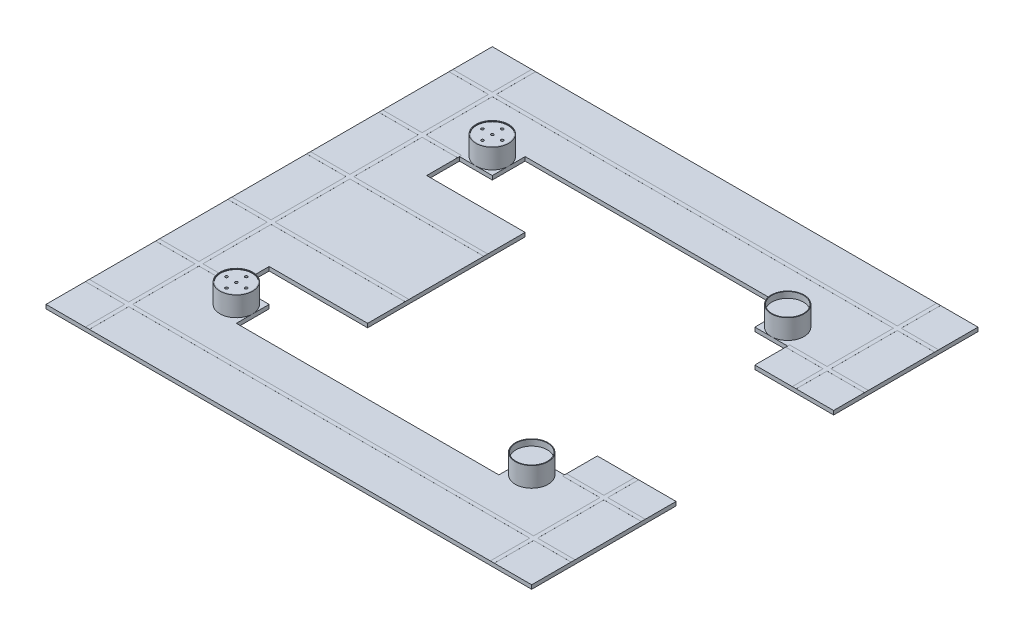
from build123d import *

# Parameters (mm, degrees)
SKETCH1_W               = 3700
SKETCH1_H               = 3400
SKETCH1_W_2             = 2500
SKETCH1_H_2             = 500
SKETCH1_W_3             = 250
SKETCH1_H_3             = 250
BOSS_EXTRUDE1_DEPTH     = 30
BOSS_EXTRUDE2_DEPTH     = 600
SKETCH3_R               = 125
BOSS_EXTRUDE3_DEPTH     = 150
SKETCH4_R               = 120
CUT_EXTRUDE1_DEPTH      = 5
SKETCH5_R               = 10
CUT_EXTRUDE2_DEPTH      = 20
MIRROR3_COPY_1_SKETCH_R = 125
MIRROR3_COPY_1_DEPTH    = 150
MIRROR3_COPY_2_SKETCH_R = 120
MIRROR3_COPY_2_DEPTH    = 5
MIRROR3_COPY_3_SKETCH_R = 10
MIRROR3_COPY_3_DEPTH    = 20
SKETCH6_R               = 120
CUT_EXTRUDE3_DEPTH      = 40
SKETCH7_W               = 300
SKETCH7_H               = 300
BOSS_EXTRUDE4_DEPTH     = 0.1
SKETCH8_W               = 3700
SKETCH8_H               = 30
SKETCH8_W_2             = 30
SKETCH8_H_2             = 3400
SKETCH8_W_3             = 600
SKETCH8_W_4             = 2350
EXTRUDE_THIN1_DEPTH     = 0.2
SKETCH9_W               = 230.740107676
SKETCH9_H               = 30
EXTRUDE_THIN2_DEPTH     = 0.1
SKETCH10_W              = 600
SKETCH10_H              = 30
EXTRUDE_THIN3_DEPTH     = 0.1
SKETCH11_R              = 21
BOSS_EXTRUDE5_DEPTH     = 350
SPLIT3_SURFACE_1_BACK   = 5040.286
SPLIT3_SURFACE_1_DEPTH  = 10080.572
SPLIT3_SURFACE_2_BACK   = 5040.286
SPLIT3_SURFACE_2_DEPTH  = 10080.572
SAVE_START              = -600
SAVE_BODIES1_DEPTH      = 1200
SPLIT5_SURFACE_3_BACK   = 5040.286
SPLIT5_SURFACE_3_DEPTH  = 10080.572
SPLIT5_SURFACE_4_BACK   = 5040.286
SPLIT5_SURFACE_4_DEPTH  = 10080.572
SAVE_BODIES2_OUTLINE_W  = 1350
SAVE_BODIES2_OUTLINE_H  = 1200
SAVE_BODIES2_DEPTH      = 380


# Read off the part's stored shape, not the designer's step: Save Bodies1, Save Bodies2
with BuildPart() as part:
    # Sketch1 → Boss-Extrude1 (new body)
    # profile 1 of 5: a face of its own
    with BuildSketch(Plane(origin=(0, 0, 0), x_dir=(1, 0, 0), z_dir=(0, 1, 0))):
        Rectangle(SKETCH1_W, SKETCH1_H)
        with Locations((0, 850)):
            Rectangle(SKETCH1_W_2, SKETCH1_H_2, mode=Mode.SUBTRACT)
        with Locations((0, -850)):
            Rectangle(SKETCH1_W_2, SKETCH1_H_2, mode=Mode.SUBTRACT)
    # profile 2 of 5: a face of its own
    with BuildSketch(Plane(origin=(0, 0, 0), x_dir=(1, 0, 0), z_dir=(0, 1, 0))):
        with Locations((-1125, 975)):
            Rectangle(SKETCH1_W_3, SKETCH1_H_3)
    # profile 3 of 5: a face of its own
    with BuildSketch(Plane(origin=(0, 0, 0), x_dir=(1, 0, 0), z_dir=(0, 1, 0))):
        with Locations((1125, 975)):
            Rectangle(SKETCH1_W_3, SKETCH1_H_3)
    # profile 4 of 5: a face of its own
    with BuildSketch(Plane(origin=(0, 0, 0), x_dir=(1, 0, 0), z_dir=(0, 1, 0))):
        with Locations((1125, -975)):
            Rectangle(SKETCH1_W_3, SKETCH1_H_3)
    # profile 5 of 5: a face of its own
    with BuildSketch(Plane(origin=(0, 0, 0), x_dir=(1, 0, 0), z_dir=(0, 1, 0))):
        with Locations((-1125, -975)):
            Rectangle(SKETCH1_W_3, SKETCH1_H_3)
    extrude(amount=BOSS_EXTRUDE1_DEPTH)

    # Sketch2 → Boss-Extrude2 (add, symmetric)
    with BuildSketch(Plane.XY):
        Polygon((-500, 30), (-300, 145.470053838), (300, 145.470053838), (500, 30), align=None)
    extrude(amount=BOSS_EXTRUDE2_DEPTH, both=True)

    # Sketch3 → Boss-Extrude3 (add)
    with BuildSketch(Plane(origin=(0, 30, 0), x_dir=(1, 0, 0), z_dir=(0, 1, 0))):
        with Locations(Location((-1125, 975, 0), (0, 0, 270))):
            Circle(SKETCH3_R)
    boss_extrude3 = extrude(amount=BOSS_EXTRUDE3_DEPTH)

    # Sketch4 → Cut-Extrude1 (cut)
    with BuildSketch(Plane(origin=(0, 180, 0), x_dir=(1, 0, 0), z_dir=(0, 1, 0))):
        with Locations(Location((-1125, 975, 0), (0, 0, 270))):
            Circle(SKETCH4_R)
    cut_extrude1 = extrude(amount=-CUT_EXTRUDE1_DEPTH, mode=Mode.SUBTRACT)

    # Sketch5 → Cut-Extrude2 (cut)
    with BuildSketch(Plane(origin=(0, 175, 0), x_dir=(1, 0, 0), z_dir=(0, 1, 0))):
        with Locations(Location((-1125, 975, 0), (0, 0, 270))):
            Circle(SKETCH5_R)
        with Locations(Location((-1050, 975, 0), (0, 0, 270))):
            Circle(SKETCH5_R)
        with Locations(Location((-1125, 900, 0), (0, 0, 270))):
            Circle(SKETCH5_R)
        with Locations(Location((-1200, 975, 0), (0, 0, 270))):
            Circle(SKETCH5_R)
        with Locations(Location((-1125, 1050, 0), (0, 0, 270))):
            Circle(SKETCH5_R)
    cut_extrude2 = extrude(amount=-CUT_EXTRUDE2_DEPTH, mode=Mode.SUBTRACT)

    # Mirror2: Boss-Extrude3, Cut-Extrude1, Cut-Extrude2 across plane
    add(boss_extrude3.mirror(Plane.XY))
    add(cut_extrude1.mirror(Plane.XY), mode=Mode.SUBTRACT)
    add(cut_extrude2.mirror(Plane.XY), mode=Mode.SUBTRACT)

    # Mirror3: Boss-Extrude3, Cut-Extrude1, Cut-Extrude2 across plane
    add(boss_extrude3.mirror(Plane(origin=(0, 0, 0), x_dir=(0, 0, 1), z_dir=(1, 0, 0))))
    add(cut_extrude1.mirror(Plane(origin=(0, 0, 0), x_dir=(0, 0, 1), z_dir=(1, 0, 0))), mode=Mode.SUBTRACT)
    add(cut_extrude2.mirror(Plane(origin=(0, 0, 0), x_dir=(0, 0, 1), z_dir=(1, 0, 0))), mode=Mode.SUBTRACT)

    # Mirror3 copy 1 sketch → Mirror3 copy 1 (add)
    with BuildSketch(Plane(origin=(0, 30, 0), x_dir=(-1, 0, 0), z_dir=(0, 1, 0))):
        with Locations(Location((-1125, 975, 0), (0, 0, 270))):
            Circle(MIRROR3_COPY_1_SKETCH_R)
    extrude(amount=MIRROR3_COPY_1_DEPTH)

    # Mirror3 copy 2 sketch → Mirror3 copy 2 (cut)
    with BuildSketch(Plane(origin=(0, 180, 0), x_dir=(-1, 0, 0), z_dir=(0, 1, 0))):
        with Locations(Location((-1125, 975, 0), (0, 0, 270))):
            Circle(MIRROR3_COPY_2_SKETCH_R)
    extrude(amount=-MIRROR3_COPY_2_DEPTH, mode=Mode.SUBTRACT)

    # Mirror3 copy 3 sketch → Mirror3 copy 3 (cut)
    with BuildSketch(Plane(origin=(0, 175, 0), x_dir=(-1, 0, 0), z_dir=(0, 1, 0))):
        with Locations(Location((-1125, 975, 0), (0, 0, 270))):
            Circle(MIRROR3_COPY_3_SKETCH_R)
        with Locations(Location((-1050, 975, 0), (0, 0, 270))):
            Circle(MIRROR3_COPY_3_SKETCH_R)
        with Locations(Location((-1125, 900, 0), (0, 0, 270))):
            Circle(MIRROR3_COPY_3_SKETCH_R)
        with Locations(Location((-1200, 975, 0), (0, 0, 270))):
            Circle(MIRROR3_COPY_3_SKETCH_R)
        with Locations(Location((-1125, 1050, 0), (0, 0, 270))):
            Circle(MIRROR3_COPY_3_SKETCH_R)
    extrude(amount=-MIRROR3_COPY_3_DEPTH, mode=Mode.SUBTRACT)

    # Sketch6 → Cut-Extrude3 (cut)
    with BuildSketch(Plane(origin=(0, 175, 0), x_dir=(1, 0, 0), z_dir=(0, 1, 0))):
        with Locations(Location((1125, 975, 0), (0, 0, 270))):
            Circle(SKETCH6_R)
    cut_extrude3 = extrude(amount=-CUT_EXTRUDE3_DEPTH, mode=Mode.SUBTRACT)

    # Mirror4: Cut-Extrude3 across plane
    add(cut_extrude3.mirror(Plane.XY), mode=Mode.SUBTRACT)

    # Sketch7 → Boss-Extrude4 (add)
    with BuildSketch(Plane(origin=(0, 30, 0), x_dir=(1, 0, 0), z_dir=(0, 1, 0))):
        with Locations((-1700, 1550)):
            Rectangle(SKETCH7_W, SKETCH7_H)
        with Locations((-1700, -1550)):
            Rectangle(SKETCH7_W, SKETCH7_H)
    extrude(amount=BOSS_EXTRUDE4_DEPTH)

    # Sketch8 → Extrude-Thin1 (add)
    with BuildSketch(Plane(origin=(0, 30, 0), x_dir=(1, 0, 0), z_dir=(0, 1, 0))):
        with Locations((0, 1385)):
            Rectangle(SKETCH8_W, SKETCH8_H)
        with Locations((-1535, 0)):
            Rectangle(SKETCH8_W_2, SKETCH8_H_2)
        with Locations((1550, 0)):
            Rectangle(SKETCH8_W_2, SKETCH8_H_2)
        with Locations((-1550, 850)):
            Rectangle(SKETCH8_W_3, SKETCH8_H)
        with Locations((-675, 300)):
            Rectangle(SKETCH8_W_4, SKETCH8_H)
        with Locations((-675, -300)):
            Rectangle(SKETCH8_W_4, SKETCH8_H)
        with Locations((0, -1385)):
            Rectangle(SKETCH8_W, SKETCH8_H)
        with Locations((-1550, -850)):
            Rectangle(SKETCH8_W_3, SKETCH8_H)
        with Locations((1550, 850)):
            Rectangle(SKETCH8_W_3, SKETCH8_H)
        with Locations((1550, -850)):
            Rectangle(SKETCH8_W_3, SKETCH8_H)
    extrude(amount=EXTRUDE_THIN1_DEPTH)

    # Sketch9 → Extrude-Thin2 (add)
    with BuildSketch(Plane(origin=(-137.990381057, 239.006350946, 0), x_dir=(0.8660254037844415, 0.4999999999999951, 0), z_dir=(-0.49999999999999517, 0.8660254037844416, 0))):
        with Locations((-302.442648054, 300)):
            Rectangle(SKETCH9_W, SKETCH9_H)
        with Locations((-302.442648054, -300)):
            Rectangle(SKETCH9_W, SKETCH9_H)
    extrude_thin2 = extrude(amount=EXTRUDE_THIN2_DEPTH)

    # Sketch10 → Extrude-Thin3 (add)
    with BuildSketch(Plane(origin=(0, 145.470053838, 0), x_dir=(1, 0, 0), z_dir=(0, 1, 0))):
        with Locations((0, 300)):
            Rectangle(SKETCH10_W, SKETCH10_H)
        with Locations((0, -300)):
            Rectangle(SKETCH10_W, SKETCH10_H)
    extrude(amount=EXTRUDE_THIN3_DEPTH)

    # Mirror5: Extrude-Thin2 across plane
    add(extrude_thin2.mirror(Plane(origin=(0, 0, 0), x_dir=(0, 0, 1), z_dir=(1, 0, 0))))

    # Sketch11 → Boss-Extrude5 (add)
    with BuildSketch(Plane(origin=(0, 30, 0), x_dir=(1, 0, 0), z_dir=(0, 1, 0))):
        with Locations(Location((850, -298.836957303, 0), (0, 0, 270))):
            Circle(SKETCH11_R)
        with Locations(Location((1050, -448.836957303, 0), (0, 0, 270))):
            Circle(SKETCH11_R)
        with Locations(Location((1450, -298.836957303, 0), (0, 0, 270))):
            Circle(SKETCH11_R)
        with Locations(Location((1250, -148.836957303, 0), (0, 0, 270))):
            Circle(SKETCH11_R)
    boss_extrude5 = extrude(amount=BOSS_EXTRUDE5_DEPTH)

    # Mirror6: Boss-Extrude5 across plane
    add(boss_extrude5.mirror(Plane.XY))


with BuildPart() as body_2:
    # Split3: the piece behind the surface
    add(part.part)
    # Split3 surface: a surface, the sketch's curves swept straight by 10080.572 mm
    with BuildLine(Plane(origin=(0, 30, 0), x_dir=(1, 0, 0), z_dir=(0, 1, 0)).offset(-SPLIT3_SURFACE_1_BACK), mode=Mode.PRIVATE) as split3_surface_1_path:
        Line((500, -600), (-500, -600))
        Line((-500, -600), (-500, 600))
        Line((-500, 600), (500, 600))
        Line((500, 600), (500, -600))
    split3_surface_1 = Shell.extrude(split3_surface_1_path.wire(), (0 * SPLIT3_SURFACE_1_DEPTH, 1 * SPLIT3_SURFACE_1_DEPTH, 0 * SPLIT3_SURFACE_1_DEPTH))
    split(bisect_by=split3_surface_1, keep=Keep.BOTTOM)

    # Save Bodies1 outline → Save Bodies1 (cut)
    with BuildSketch(Plane.XY.offset(SAVE_START)):
        Polygon((500, 30.2), (499.853589838, 30.2), (300.05, 145.556656378), (300, 145.470053838), (300, 145.570053838), (-300, 145.570053838), (-300, 145.470053838), (-300.05, 145.556656378), (-499.853589838, 30.2), (-500, 30.2), (-500, 0), (500, 0), align=None)
    extrude(amount=SAVE_BODIES1_DEPTH, mode=Mode.SUBTRACT)


with BuildPart() as part_1:
    add(part.part)

    # Split3: split by a surface, the side it looks to stays
    # Split3 surface: a surface, the sketch's curves swept straight by 10080.572 mm
    with BuildLine(Plane(origin=(0, 30, 0), x_dir=(1, 0, 0), z_dir=(0, 1, 0)).offset(-SPLIT3_SURFACE_2_BACK), mode=Mode.PRIVATE) as split3_surface_2_path:
        Line((500, -600), (-500, -600))
        Line((-500, -600), (-500, 600))
        Line((-500, 600), (500, 600))
        Line((500, 600), (500, -600))
    split3_surface_2 = Shell.extrude(split3_surface_2_path.wire(), (0 * SPLIT3_SURFACE_2_DEPTH, 1 * SPLIT3_SURFACE_2_DEPTH, 0 * SPLIT3_SURFACE_2_DEPTH))
    split(bisect_by=split3_surface_2, keep=Keep.TOP)


with BuildPart() as body_2_2:
    # Split5: the piece behind the surface
    add(part_1.part)
    # Split5 surface: a surface, the sketch's curves swept straight by 10080.572 mm
    with BuildLine(Plane(origin=(0, 30, 0), x_dir=(1, 0, 0), z_dir=(0, 1, 0)).offset(-SPLIT5_SURFACE_3_BACK), mode=Mode.PRIVATE) as split5_surface_3_path:
        Line((500, 600), (1850, 600))
        Line((1850, 600), (1850, -600))
        Line((1850, -600), (500, -600))
        Line((500, -600), (500, 600))
    split5_surface_3 = Shell.extrude(split5_surface_3_path.wire(), (0 * SPLIT5_SURFACE_3_DEPTH, 1 * SPLIT5_SURFACE_3_DEPTH, 0 * SPLIT5_SURFACE_3_DEPTH))
    split(bisect_by=split5_surface_3, keep=Keep.BOTTOM)

    # Save Bodies2 outline → Save Bodies2 (cut)
    with BuildSketch(Plane(origin=(0, 0, 0), x_dir=(1, 0, 0), z_dir=(0, 1, 0))):
        with Locations((1175, 0)):
            Rectangle(SAVE_BODIES2_OUTLINE_W, SAVE_BODIES2_OUTLINE_H)
    extrude(amount=SAVE_BODIES2_DEPTH, mode=Mode.SUBTRACT)


with BuildPart() as part_2:
    add(part_1.part)

    # Split5: split by a surface, the side it looks to stays
    # Split5 surface: a surface, the sketch's curves swept straight by 10080.572 mm
    with BuildLine(Plane(origin=(0, 30, 0), x_dir=(1, 0, 0), z_dir=(0, 1, 0)).offset(-SPLIT5_SURFACE_4_BACK), mode=Mode.PRIVATE) as split5_surface_4_path:
        Line((500, 600), (1850, 600))
        Line((1850, 600), (1850, -600))
        Line((1850, -600), (500, -600))
        Line((500, -600), (500, 600))
    split5_surface_4 = Shell.extrude(split5_surface_4_path.wire(), (0 * SPLIT5_SURFACE_4_DEPTH, 1 * SPLIT5_SURFACE_4_DEPTH, 0 * SPLIT5_SURFACE_4_DEPTH))
    split(bisect_by=split5_surface_4, keep=Keep.TOP)


solid = part_2.part
